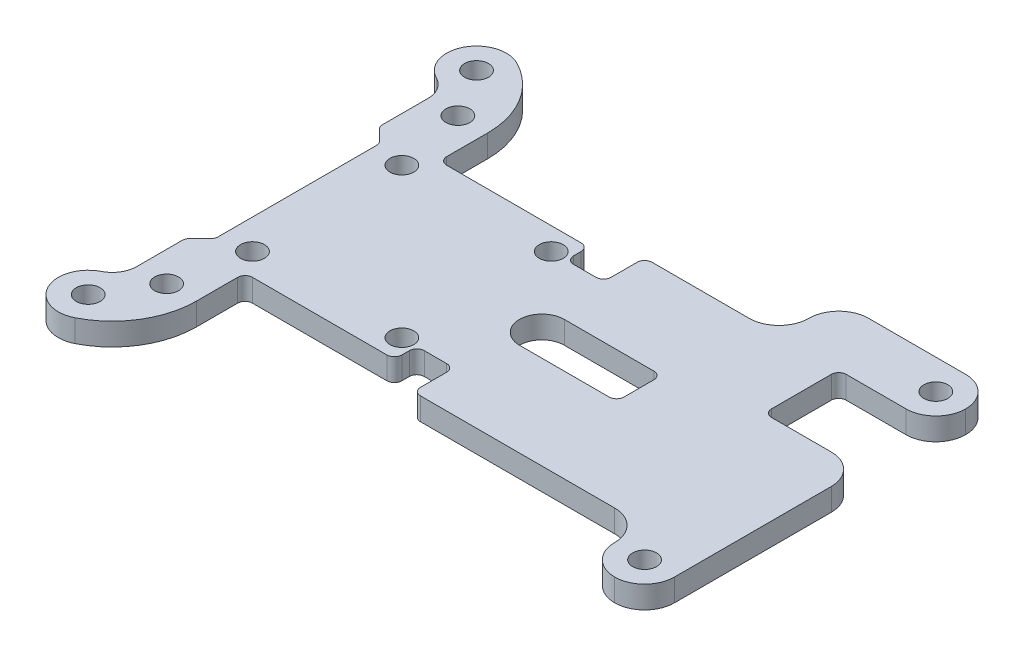
from build123d import *

# Parameters (mm, degrees)
CROQUIS1_W              = 72
CROQUIS1_H              = 47
SALIENTE_EXTRUIR1_DEPTH = 3
CROQUIS3_W              = 13
CROQUIS3_H              = 10
CROQUIS3_W_2            = 2
CROQUIS3_H_2            = 21
CORTAR_EXTRUIR2_DEPTH   = 44.095823464
CROQUIS2_R              = 1.6
CORTAR_EXTRUIR1_DEPTH   = 44.095823464
CORTAR_EXTRUIR3_DEPTH   = 34.75
CROQUIS5_R              = 1.6
CORTAR_EXTRUIR7_DEPTH   = 10
CHAFL_N1_SIZE           = 2.5
REDONDEO2_R             = 1
CROQUIS6_R              = 1.6
SALIENTE_EXTRUIR2_DEPTH = 3
REDONDEO1_R             = 4


# Some blends are built 0.0001 mm under size
with BuildPart() as part:
    # Croquis1 → Saliente-Extruir1 (new body)
    with BuildSketch(Plane(origin=(0, 0, 0), x_dir=(1, 0, 0), z_dir=(0, 1, 0))):
        Rectangle(CROQUIS1_W, CROQUIS1_H)
    extrude(amount=SALIENTE_EXTRUIR1_DEPTH)

    # Croquis3 → Cortar-Extruir2 (cut, through all)
    with BuildSketch(Plane(origin=(0, 3, 0), x_dir=(1, 0, 0), z_dir=(0, 1, 0))):
        Polygon((-8, 13), (-8, 10), (-3, 10), (-3, 15.5), (15, 15.5), (15, 23.5), (-36, 23.5), (-36, 19.5), (-28, 19.5), (-28, 13), align=None)
        Polygon((-28, -13), (-8, -13), (-8, -10), (-3, -10), (-3, -15.5), (28, -15.5), (28, -23.5), (-36, -23.5), (-36, -19.5), (-28, -19.5), align=None)
        with Locations((29.5, 10.5)):
            Rectangle(CROQUIS3_W, CROQUIS3_H)
        with Locations((-35, 0)):
            Rectangle(CROQUIS3_W_2, CROQUIS3_H_2)
    extrude(amount=-CORTAR_EXTRUIR2_DEPTH, mode=Mode.SUBTRACT)

    # Croquis2 → Cortar-Extruir1 (cut, through all)
    with BuildSketch(Plane(origin=(0, 3, 0), x_dir=(1, 0, 0), z_dir=(0, 1, 0))):
        with Locations((-32, 19.5)):
            Circle(CROQUIS2_R)
        with Locations(Location((32, 19.5, 0), (0, 0, 270))):
            Circle(CROQUIS2_R)
        with Locations(Location((32, -19.5, 0), (0, 0, 270))):
            Circle(CROQUIS2_R)
        with Locations((-32, -19.5)):
            Circle(CROQUIS2_R)
    extrude(amount=-CORTAR_EXTRUIR1_DEPTH, mode=Mode.SUBTRACT)

    # Croquis4 → Cortar-Extruir3 (cut)
    with BuildSketch(Plane(origin=(0, 3, 0), x_dir=(1, 0, 0), z_dir=(0, 1, 0))):
        with BuildLine():
            Line((-1.25, -3), (11.75, -3))
            Line((11.75, -3), (11.75, 3))
            Line((11.75, 3), (-1.25, 3))
            ThreePointArc((-1.25, 3), (-4.25, 0), (-1.25, -3))
        make_face()
    extrude(amount=-CORTAR_EXTRUIR3_DEPTH, mode=Mode.SUBTRACT)

    # Croquis5 → Cortar-Extruir7 (cut)
    with BuildSketch(Plane(origin=(0, 3, -3), x_dir=(1, 0, 0), z_dir=(0, -1, 0))):
        with Locations(Location((-30, 13, 0), (0, 0, 270))):
            Circle(CROQUIS5_R)
        with Locations(Location((-30, -7, 0), (0, 0, 270))):
            Circle(CROQUIS5_R)
        with Locations(Location((-10, 13, 0), (0, 0, 270))):
            Circle(CROQUIS5_R)
        with Locations(Location((-10, -7, 0), (0, 0, 270))):
            Circle(CROQUIS5_R)
    extrude(amount=CORTAR_EXTRUIR7_DEPTH, mode=Mode.SUBTRACT)

    # Chaflán1
    # the kernel refuses this chamfer: 2.5 mm, written as the material it takes off along each edge
    with BuildSketch(Plane(origin=(-36, 9.42920747, 10.5), x_dir=(-0.0274958766105877, 0, 0.9996219169112968), z_dir=(0, -1, 0))) as chafl_n1_piece_1_section:
        Polygon((CHAFL_N1_SIZE * 0.999621916911, -CHAFL_N1_SIZE * 0.0274958766106), (-CHAFL_N1_SIZE * 0.0274958766106, -CHAFL_N1_SIZE * 0.999621916911), (0, 0), align=None)
    chafl_n1_piece_1 = extrude(amount=15.85841494, mode=Mode.PRIVATE)
    chafl_n1_piece_1 = split(chafl_n1_piece_1, bisect_by=Plane(origin=(-34, 1.5, 11.364296031), z_dir=(-1, 0, 0)), keep=Keep.TOP, mode=Mode.PRIVATE)
    add(chafl_n1_piece_1, mode=Mode.SUBTRACT)
    with BuildSketch(Plane(origin=(-36, 9.42920747, -10.5), x_dir=(0.9996219169112968, 0, 0.027495876610586282), z_dir=(0, -1, 0))) as chafl_n1_piece_2_section:
        Polygon((CHAFL_N1_SIZE * 0.999621916911, -CHAFL_N1_SIZE * 0.0274958766106), (-CHAFL_N1_SIZE * 0.0274958766106, -CHAFL_N1_SIZE * 0.999621916911), (0, 0), align=None)
    chafl_n1_piece_2 = extrude(amount=15.85841494, mode=Mode.PRIVATE)
    chafl_n1_piece_2 = split(chafl_n1_piece_2, bisect_by=Plane(origin=(-34, 1.5, -11.364296031), z_dir=(-1, 0, 0)), keep=Keep.TOP, mode=Mode.PRIVATE)
    add(chafl_n1_piece_2, mode=Mode.SUBTRACT)

    # Redondeo2
    redondeo2_edges = [part.edges().sort_by_distance(p)[0] for p in [
        (11.75, 1.5, -3),
        (11.75, 1.5, 3),
        (-36, 1.5, 13),
        (-36, 1.5, -13),
        (-34, 1.5, 11),
        (-34, 1.5, -11),
        (-8, 1.5, -13),
        (-28, 1.5, -13),
        (-3, 1.5, -15.5),
        (-3, 1.5, -10),
        (-8, 1.5, -10),
        (-28, 1.5, 13),
        (-8, 1.5, 13),
        (-8, 1.5, 10),
        (-3, 1.5, 10),
        (-3, 1.5, 15.5),
        (23, 1.5, -5.5),
        (23, 1.5, -15.5),
    ]]
    fillet(redondeo2_edges, radius=REDONDEO2_R)

    # Croquis6 → Saliente-Extruir2 (add, through all)
    with BuildSketch(Plane(origin=(0, 3, 0), x_dir=(1, 0, 0), z_dir=(0, 1, 0))):
        with BuildLine():
            ThreePointArc((-34.197424136, -29.570815068), (-29.673479987, -25.412473854), (-28, -19.500000848))
            ThreePointArc((-28, -19.500000848), (-31.999999152, -15.5), (-36, -19.499999152))
            ThreePointArc((-36, -19.499999152), (-36.48674652, -21.219694449), (-37.802575864, -22.429184932))
            ThreePointArc((-37.802575864, -22.429184932), (-39.570815068, -27.802575864), (-34.197424136, -29.570815068))
        make_face()
        with Locations(Location((-36, -26, 0), (0, 0, 270))):
            Circle(CROQUIS6_R, mode=Mode.SUBTRACT)
        with Locations(Location((-32, -19.5, 0), (0, 0, 270))):
            Circle(CROQUIS6_R, mode=Mode.SUBTRACT)
    saliente_extruir2 = extrude(amount=-SALIENTE_EXTRUIR2_DEPTH)

    # Simetría1: Saliente-Extruir2 across plane
    add(saliente_extruir2.mirror(Plane.XY))

    # Redondeo1
    redondeo1_edges = [part.edges().sort_by_distance(p)[0] for p in [
        (36, 1.5, -23.5),
        (36, 1.5, 23.5),
        (15, 1.5, -23.5),
        (15, 1.5, -15.5),
        (28, 1.5, 15.5),
        (36, 1.5, -5.5),
        (36, 1.5, -15.5),
        (28, 1.5, 23.5),
    ]]
    fillet(redondeo1_edges, radius=REDONDEO1_R - 0.0001)  # a hair under: the kernel refuses the full size


solid = part.part
